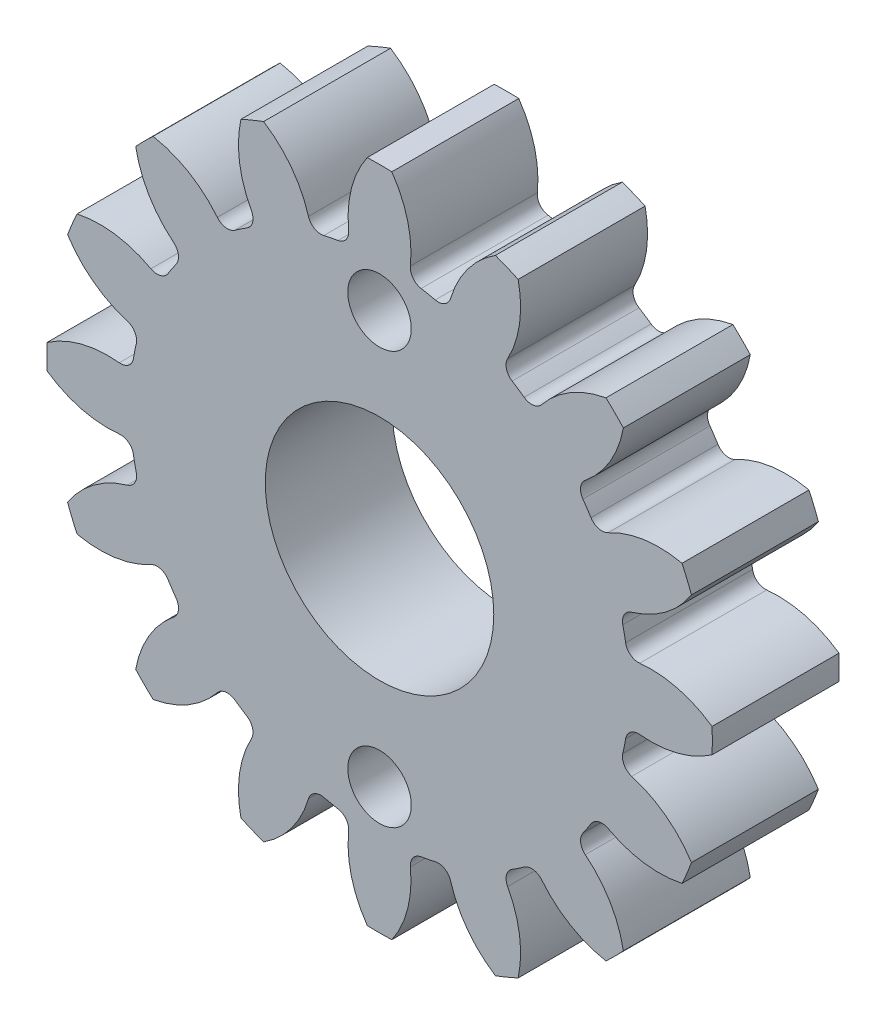
from build123d import *

# Parameters (mm, degrees)
ESQUISSE1_R                        = 1.15
BASE_EXTRUSION_DEPTH               = 2.5
BOSS_EXTRU_1_DEPTH                 = 4
CONG_1_R                           = 0.40775
R_P_TITION_CIRCULAIRE4_COUNT       = 16
CONG_1_OF_R_P_TITION_CIRCULAIRE4_R = 0.40775
ESQUISSE8_R                        = 3.6
ENL_V_MAT_EXTRU_1_DEPTH            = 16.358074586
ESQUISSE9_R                        = 1
ENL_V_MAT_EXTRU_2_DEPTH            = 16.358074586


with BuildPart() as part:
    # Esquisse1 → Base-Extrusion (new body)
    with BuildSketch(Plane.XY):
        Circle(ESQUISSE1_R)
    extrude(amount=BASE_EXTRUSION_DEPTH)

    # Esquisse3 → Boss.-Extru.1 (add)
    with BuildSketch(Plane.XY):
        with BuildLine():
            Line((-1.53414152, 7.712650249), (0, 0))
            Line((0, 0), (1.53414152, 7.712650249))
            ThreePointArc((1.53414152, 7.712650249), (1.222047708, 7.768214947), (0.907968022, 7.811156005))
            ThreePointArc((0.907968022, 7.811156005), (0.929201465, 9.199391503), (0.387682352, 10.477830281))
            ThreePointArc((0.387682352, 10.477830281), (0, 10.485), (-0.387682352, 10.477830281))
            ThreePointArc((-0.387682352, 10.477830281), (-0.929201465, 9.199391503), (-0.907968022, 7.811156005))
            ThreePointArc((-0.907968022, 7.811156005), (-1.222047708, 7.768214947), (-1.53414152, 7.712650249))
        make_face()
    boss_extru_1 = extrude(amount=BOSS_EXTRU_1_DEPTH)

    # Congé1
    cong_1_edges = [part.edges().sort_by_distance(p)[0] for p in [
        (0.907968022, 7.811156005, 2),
        (-0.907968022, 7.811156005, 2),
    ]]
    fillet(cong_1_edges, radius=CONG_1_R)

    # Répétition circulaire4: Boss.-Extru.1 ×16 about axis
    r_p_tition_circulaire4_axis = Axis((0, 0, 54), (0, 0, -1))
    for i in range(1, R_P_TITION_CIRCULAIRE4_COUNT):
        add(boss_extru_1.rotate(r_p_tition_circulaire4_axis, i * 360 / R_P_TITION_CIRCULAIRE4_COUNT))

    # Congé1 of Répétition circulaire4
    cong_1_of_r_p_tition_circulaire4_edges = [part.edges().sort_by_distance(p)[0] for p in [
        (3.828053063, 6.869102839, 2),
        (2.150346919, 7.564031477, 2),
        (6.165351726, 4.881291034, 2),
        (4.881291034, 6.165351726, 2),
        (7.564031477, 2.150346919, 2),
        (6.869102839, 3.828053063, 2),
        (7.811156005, -0.907968022, 2),
        (7.811156005, 0.907968022, 2),
        (6.869102839, -3.828053063, 2),
        (7.564031477, -2.150346919, 2),
        (4.881291034, -6.165351726, 2),
        (6.165351726, -4.881291034, 2),
        (2.150346919, -7.564031477, 2),
        (3.828053063, -6.869102839, 2),
        (-0.907968022, -7.811156005, 2),
        (0.907968022, -7.811156005, 2),
        (-3.828053063, -6.869102839, 2),
        (-2.150346919, -7.564031477, 2),
        (-6.165351726, -4.881291034, 2),
        (-4.881291034, -6.165351726, 2),
        (-7.564031477, -2.150346919, 2),
        (-6.869102839, -3.828053063, 2),
        (-7.811156005, 0.907968022, 2),
        (-7.811156005, -0.907968022, 2),
        (-6.869102839, 3.828053063, 2),
        (-7.564031477, 2.150346919, 2),
        (-4.881291034, 6.165351726, 2),
        (-6.165351726, 4.881291034, 2),
        (-2.150346919, 7.564031477, 2),
        (-3.828053063, 6.869102839, 2),
    ]]
    fillet(cong_1_of_r_p_tition_circulaire4_edges, radius=CONG_1_OF_R_P_TITION_CIRCULAIRE4_R)

    # Esquisse8 → Enlèv. mat.-Extru.1 (cut, through all)
    with BuildSketch(Plane.XY.offset(4)):
        Circle(ESQUISSE8_R)
    extrude(amount=-ENL_V_MAT_EXTRU_1_DEPTH, mode=Mode.SUBTRACT)

    # Esquisse9 → Enlèv. mat.-Extru.2 (cut, through all)
    with BuildSketch(Plane(origin=(0, 0, 0), x_dir=(-1, 0, 0), z_dir=(0, 0, -1))):
        with Locations((0, 6.5)):
            Circle(ESQUISSE9_R)
        with Locations((0, -6.5)):
            Circle(ESQUISSE9_R)
    extrude(amount=-ENL_V_MAT_EXTRU_2_DEPTH, mode=Mode.SUBTRACT)


solid = part.part
